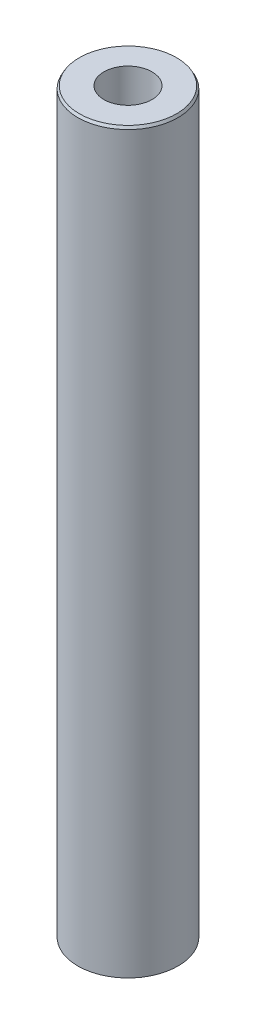
from build123d import *
from OCP.BRepFilletAPI import BRepFilletAPI_MakeChamfer

# Parameters (mm, degrees)
SKETCH1_R           = 30
BOSS_EXTRUDE1_DEPTH = 442.221871574
SKETCH2_R           = 14.399924431
CUT_EXTRUDE1_DEPTH  = 445.252387387
CHAMFER1_SIZE       = 1.560290523
CHAMFER1_SIZE2      = 0.900834153


with BuildPart() as part:
    # Sketch1 → Boss-Extrude1 (new body)
    with BuildSketch(Plane(origin=(0, 0, 0), x_dir=(1, 0, 0), z_dir=(0, 1, 0))):
        Circle(SKETCH1_R)
    extrude(amount=BOSS_EXTRUDE1_DEPTH)

    # Sketch2 → Cut-Extrude1 (cut, through all)
    with BuildSketch(Plane(origin=(0, 0, 0), x_dir=(1, 0, 0), z_dir=(0, 1, 0))):
        Circle(SKETCH2_R)
    extrude(amount=CUT_EXTRUDE1_DEPTH, mode=Mode.SUBTRACT)

    # Chamfer1: one chamfer whose edges measure the first distance from different faces: ONE call of the kernel's chamfer builder (chamfer() names one face for all edges)
    chamfer1_edges_1 = [part.edges().sort_by_distance(p)[0] for p in [
        (-30, 442.221871574, 0),
    ]]
    chamfer1_side_1 = [part.faces().sort_by_distance(p)[0] for p in [
        (-30, 221.110935787, 0),
    ]]
    chamfer1_edges_2 = [part.edges().sort_by_distance(p)[0] for p in [
        (-30, 0, 0),
    ]]
    chamfer1_side_2 = [part.faces().sort_by_distance(p)[0] for p in [
        (-29.151471863, 0, 0),
    ]]
    chamfer1 = BRepFilletAPI_MakeChamfer(part.part.solid().wrapped)
    for e in chamfer1_edges_1:
        chamfer1.Add(CHAMFER1_SIZE, CHAMFER1_SIZE2, e.wrapped, chamfer1_side_1[0].wrapped)  # the first distance lies on this face
    for e in chamfer1_edges_2:
        chamfer1.Add(CHAMFER1_SIZE, CHAMFER1_SIZE2, e.wrapped, chamfer1_side_2[0].wrapped)  # the first distance lies on this face
    add(Compound.cast(chamfer1.Shape()), mode=Mode.REPLACE)


solid = part.part
